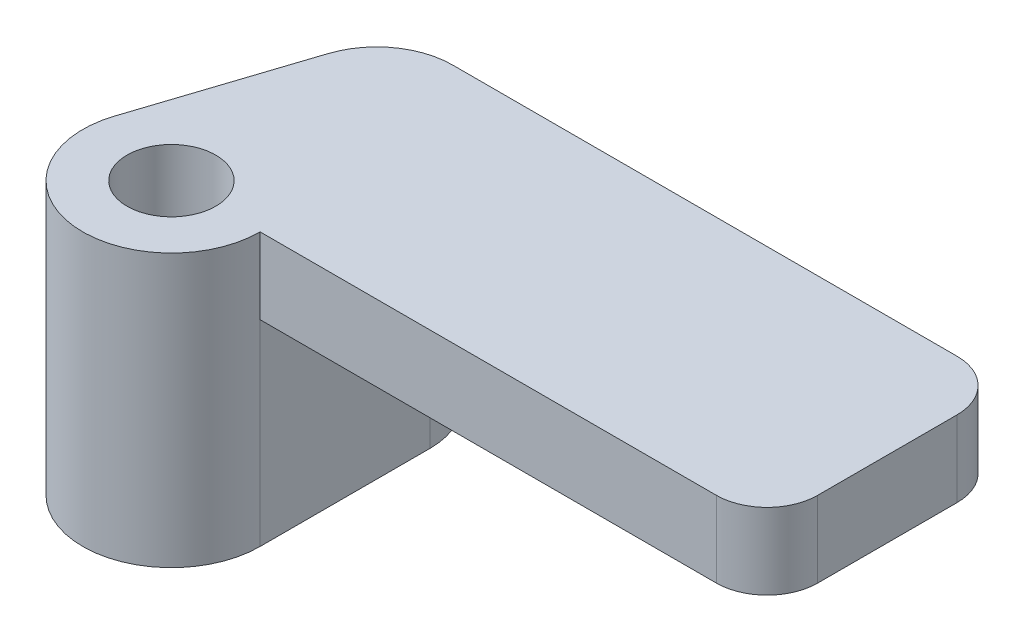
from build123d import *

# Parameters (mm, degrees)
SKETCH1_W           = 20
SKETCH1_H           = 9.5
BOSS_EXTRUDE1_DEPTH = 3
SKETCH2_R           = 1.75
BOSS_EXTRUDE2_DEPTH = 10.75
FILLET1_R           = 3
FILLET2_R           = 3
FILLET3_R           = 2


with BuildPart() as part:
    # Sketch1 → Boss-Extrude1 (new body)
    with BuildSketch(Plane(origin=(0, 0, 0), x_dir=(1, 0, 0), z_dir=(0, 1, 0))):
        Rectangle(SKETCH1_W, SKETCH1_H)
    extrude(amount=BOSS_EXTRUDE1_DEPTH)

    # Sketch2 → Boss-Extrude2 (add)
    with BuildSketch(Plane(origin=(0, 3, 0), x_dir=(1, 0, 0), z_dir=(0, 1, 0))):
        with BuildLine():
            Line((-14.075613498, 4.75), (-16.826627584, -3.662089657))
            ThreePointArc((-16.826627584, -3.662089657), (-14.050819142, -8.206385145), (-10, -4.75))
            Line((-10, -4.75), (-10, 4.75))
            Line((-10, 4.75), (-14.075613498, 4.75))
        make_face()
        with Locations(Location((-13.5, -4.75, 0), (0, 0, 270))):
            Circle(SKETCH2_R, mode=Mode.SUBTRACT)
    extrude(amount=-BOSS_EXTRUDE2_DEPTH)

    # Fillet1
    fillet1_edges = [part.edges().sort_by_distance(p)[0] for p in [
        (-14.075613498, -2.375, -4.75),
    ]]
    fillet(fillet1_edges, radius=FILLET1_R)

    # Fillet2
    # the kernel refuses this fillet: 3 mm, written as the material it takes off along each edge
    with BuildSketch(Plane(origin=(-10, 0, -4.75), x_dir=(-1, 0, 0), z_dir=(0, -1, 0))) as fillet2_piece_1:
        with BuildLine():
            CenterArc((3, -2.791197737), FILLET2_R, 111.502864163, 68.497135837)
            Line((0, -2.791197737), (0, 0))
            Line((0, 0), (1.900356789, 0))
        make_face()
    extrude(amount=14.727994343, mode=Mode.SUBTRACT)

    # Fillet3
    fillet3_edges = [part.edges().sort_by_distance(p)[0] for p in [
        (10, 1.5, 4.75),
        (10, 1.5, -4.75),
    ]]
    fillet(fillet3_edges, radius=FILLET3_R)


solid = part.part
